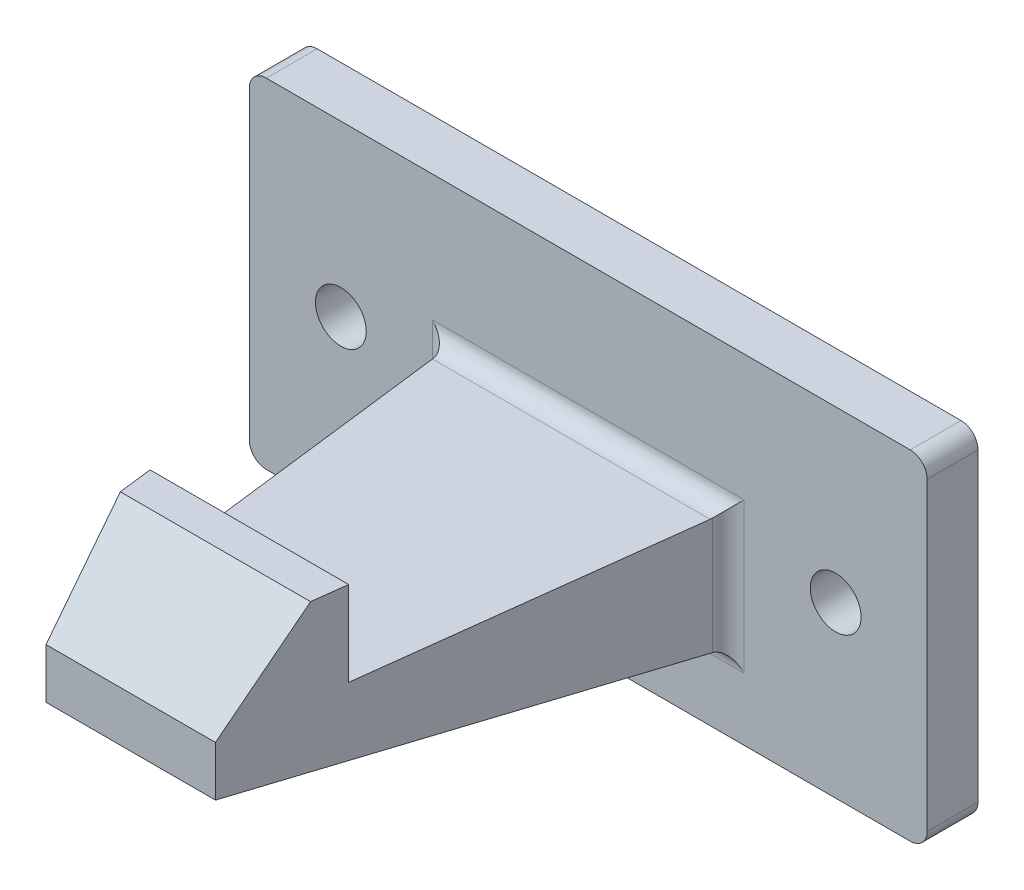
from build123d import *

# Parameters (mm, degrees)
SKETCH1_W           = 40
SKETCH1_H           = 20
BOSS_EXTRUDE1_DEPTH = 3
SNAP_START          = -1.4
SNAP_HOOK1_DEPTH    = 2.95
SNAP_START_2        = -8.315183144
SNAP_HOOK1_2_DEPTH  = 16.630366288
SNAP_START_3        = -5.859491926
SNAP_HOOK1_3_DEPTH  = 11.718983852
SNAP_START_4        = -6
SNAP_HOOK1_4_DEPTH  = 14
FILLET1_R           = 1
CUT_EXTRUDE1_REACH  = 37.057
SKETCH3_R           = 1.5
FILLET2_R           = 1


with BuildPart() as part:
    # Sketch1 → Boss-Extrude1 (new body)
    with BuildSketch(Plane.XY):
        Rectangle(SKETCH1_W, SKETCH1_H)
    extrude(amount=BOSS_EXTRUDE1_DEPTH)

    # Snap Hook1: read off the stored shape, not the designer's step
    # Snap Hook1 outline → Snap Hook1 (add)
    with BuildSketch(Plane(origin=(0, 0, 0), x_dir=(1, 0, 0), z_dir=(0, 1, 0)).offset(SNAP_START)):
        Polygon((8.315183144, -3), (-8.315183144, -3), (-5, -30), (5, -30), align=None)
    extrude(amount=SNAP_HOOK1_DEPTH)

    # Snap Hook1 2 outline → Snap Hook1 2 (add)
    with BuildSketch(Plane.YZ.offset(SNAP_START_2)):
        Polygon((-1.4, 3), (-1.4, 30), (-5.45, 3), align=None)
    extrude(amount=SNAP_HOOK1_2_DEPTH)

    # Snap Hook1 3 outline → Snap Hook1 3 (add)
    with BuildSketch(Plane.YZ.offset(SNAP_START_3)):
        Polygon((1.55, 30), (1.55, 23), (6.55, 23), (6.55, 25), align=None)
    extrude(amount=SNAP_HOOK1_3_DEPTH)

    # Snap Hook1 4 outline → Snap Hook1 4 (cut)
    with BuildSketch(Plane(origin=(0, 0, 0), x_dir=(1, 0, 0), z_dir=(0, 1, 0)).offset(SNAP_START_4)):
        Polygon((-8.315183144, -3), (-8.315183144, -31), (-4.877215439, -31), (-5, -30), align=None)
        Polygon((5, -30), (4.877215439, -31), (8.315183144, -31), (8.315183144, -3), align=None)
    extrude(amount=SNAP_HOOK1_4_DEPTH, mode=Mode.SUBTRACT)

    # Fillet1
    # the kernel refuses this fillet: 1 mm, written as the material it adds along each edge
    with BuildSketch(Plane(origin=(10.815183144, 1.55, 3), x_dir=(0, 1, 0), z_dir=(-1, 0, 0))) as fillet1_piece_1_section:
        with BuildLine():
            CenterArc((FILLET1_R, -FILLET1_R), FILLET1_R, 90, 90)
            Line((0, -FILLET1_R), (0, 0))
            Line((0, 0), (FILLET1_R, 0))
        make_face()
    fillet1_piece_1 = extrude(amount=21.630366288, mode=Mode.PRIVATE)
    fillet1_piece_1 = split(fillet1_piece_1, bisect_by=Plane(origin=(-8.031056326, 1.55, 5.314027238), z_dir=(0.9925461516430047, 0, -0.12186934339144287)), keep=Keep.TOP, mode=Mode.PRIVATE)
    fillet1_piece_1 = split(fillet1_piece_1, bisect_by=Plane(origin=(8.352313486, 1.55, 2.697597631), z_dir=(-0.9925461516430047, 0, -0.12186934339144287)), keep=Keep.TOP, mode=Mode.PRIVATE)
    add(fillet1_piece_1)
    with BuildSketch(Plane(origin=(8.315183144, 1.55, 3), x_dir=(1, 0, 0), z_dir=(0, -1, 0))) as fillet1_piece_2_section:
        with BuildLine():
            CenterArc((FILLET1_R * 0.884725264568, FILLET1_R), FILLET1_R, 186.999999999, 83.000000001)
            Line((-FILLET1_R * 0.107820887075, FILLET1_R * 0.878130656609), (0, 0))
            Line((0, 0), (FILLET1_R * 0.884725264568, 0))
        make_face()
    fillet1_piece_2 = extrude(amount=9.211813161, mode=Mode.PRIVATE)
    fillet1_piece_2 = split(fillet1_piece_2, bisect_by=Plane(origin=(8.315183144, -5.29596577, 4.026894866), z_dir=(0, 0.9889363528682975, -0.14834045293024464)), keep=Keep.TOP, mode=Mode.PRIVATE)
    add(fillet1_piece_2)
    with BuildSketch(Plane(origin=(-10.468151696, -5.45, 3), x_dir=(0, -1, 0), z_dir=(1, 0, 0))) as fillet1_piece_3_section:
        with BuildLine():
            CenterArc((FILLET1_R * 0.861187420808, -FILLET1_R), FILLET1_R, 90, 81.46923439)
            Line((-FILLET1_R * 0.12774893206, -FILLET1_R * 0.85165954707), (0, 0))
            Line((0, 0), (FILLET1_R * 0.861187420808, 0))
        make_face()
    fillet1_piece_3 = extrude(amount=20.936303392, mode=Mode.PRIVATE)
    fillet1_piece_3 = split(fillet1_piece_3, bisect_by=Plane(origin=(-8.347159328, -5.45, 2.739574883), z_dir=(0.9925461516430047, 0, -0.12186934339144287)), keep=Keep.TOP, mode=Mode.PRIVATE)
    fillet1_piece_3 = split(fillet1_piece_3, bisect_by=Plane(origin=(8.036210484, -5.45, 5.272049985), z_dir=(-0.9925461516430047, 0, -0.12186934339144287)), keep=Keep.TOP, mode=Mode.PRIVATE)
    add(fillet1_piece_3)
    with BuildSketch(Plane(origin=(-8.315183144, -7.661813161, 3), x_dir=(-1, 0, 0), z_dir=(0, 1, 0))) as fillet1_piece_4_section:
        with BuildLine():
            CenterArc((FILLET1_R * 0.884725264568, FILLET1_R), FILLET1_R, 186.999999999, 83.000000001)
            Line((-FILLET1_R * 0.107820887075, FILLET1_R * 0.878130656609), (0, 0))
            Line((0, 0), (FILLET1_R * 0.884725264568, 0))
        make_face()
    fillet1_piece_4 = extrude(amount=9.211813161, mode=Mode.PRIVATE)
    fillet1_piece_4 = split(fillet1_piece_4, bisect_by=Plane(origin=(-8.315183144, -5.498670705, 2.675528632), z_dir=(0, 0.9889363528682975, -0.14834045293024464)), keep=Keep.TOP, mode=Mode.PRIVATE)
    add(fillet1_piece_4)
    with BuildSketch(Plane(origin=(8.315183144, 3.761813161, 3), x_dir=(1, 0, 0), z_dir=(0, -1, 0))) as fillet1_piece_5a_section:
        with BuildLine():
            CenterArc((FILLET1_R * 0.884725264568, FILLET1_R), FILLET1_R, 186.999999999, 83.000000001)
            Line((-FILLET1_R * 0.107820887075, FILLET1_R * 0.878130656609), (0, 0))
            Line((0, 0), (FILLET1_R * 0.884725264568, 0))
        make_face()
    fillet1_piece_5a = extrude(amount=11.423626323, mode=Mode.PRIVATE)
    fillet1_piece_5a = split(fillet1_piece_5a, bisect_by=Plane(origin=(8.315183144, 1.55, 3), z_dir=(0, 1, 0)), keep=Keep.TOP, mode=Mode.PRIVATE)
    with BuildSketch(Plane(origin=(10.815183144, 1.55, 3), x_dir=(0, 1, 0), z_dir=(-1, 0, 0))) as fillet1_piece_5b_section:
        with BuildLine():
            CenterArc((FILLET1_R, -FILLET1_R), FILLET1_R, 90, 90)
            Line((0, -FILLET1_R), (0, 0))
            Line((0, 0), (FILLET1_R, 0))
        make_face()
    fillet1_piece_5b = extrude(amount=21.630366288, mode=Mode.PRIVATE)
    fillet1_piece_5b = split(fillet1_piece_5b, bisect_by=Plane(origin=(8.352313486, 1.55, 2.697597631), z_dir=(0.9925461516430047, 0, 0.12186934339144287)), keep=Keep.TOP, mode=Mode.PRIVATE)
    fillet1_piece_5 = fillet1_piece_5a & fillet1_piece_5b
    add(fillet1_piece_5)
    with BuildSketch(Plane(origin=(10.815183144, 1.55, 3), x_dir=(0, 1, 0), z_dir=(-1, 0, 0))) as fillet1_piece_6a_section:
        with BuildLine():
            CenterArc((FILLET1_R, -FILLET1_R), FILLET1_R, 90, 90)
            Line((0, -FILLET1_R), (0, 0))
            Line((0, 0), (FILLET1_R, 0))
        make_face()
    fillet1_piece_6a = extrude(amount=21.630366288, mode=Mode.PRIVATE)
    fillet1_piece_6a = split(fillet1_piece_6a, bisect_by=Plane(origin=(-8.031056326, 1.55, 5.314027238), z_dir=(-0.9925461516430047, 0, 0.12186934339144287)), keep=Keep.TOP, mode=Mode.PRIVATE)
    with BuildSketch(Plane(origin=(-8.315183144, -7.661813161, 3), x_dir=(-1, 0, 0), z_dir=(0, 1, 0))) as fillet1_piece_6b_section:
        with BuildLine():
            CenterArc((FILLET1_R * 0.884725264568, FILLET1_R), FILLET1_R, 186.999999999, 83.000000001)
            Line((-FILLET1_R * 0.107820887075, FILLET1_R * 0.878130656609), (0, 0))
            Line((0, 0), (FILLET1_R * 0.884725264568, 0))
        make_face()
    fillet1_piece_6b = extrude(amount=11.423626323, mode=Mode.PRIVATE)
    fillet1_piece_6b = split(fillet1_piece_6b, bisect_by=Plane(origin=(-8.315183144, 1.55, 3), z_dir=(0, 1, 0)), keep=Keep.TOP, mode=Mode.PRIVATE)
    fillet1_piece_6 = fillet1_piece_6a & fillet1_piece_6b
    add(fillet1_piece_6)
    with BuildSketch(Plane(origin=(-10.468151696, -5.45, 3), x_dir=(0, -1, 0), z_dir=(1, 0, 0))) as fillet1_piece_7a_section:
        with BuildLine():
            CenterArc((FILLET1_R * 0.861187420808, -FILLET1_R), FILLET1_R, 90, 81.46923439)
            Line((-FILLET1_R * 0.12774893206, -FILLET1_R * 0.85165954707), (0, 0))
            Line((0, 0), (FILLET1_R * 0.861187420808, 0))
        make_face()
    fillet1_piece_7a = extrude(amount=20.936303392, mode=Mode.PRIVATE)
    fillet1_piece_7a = split(fillet1_piece_7a, bisect_by=Plane(origin=(8.036210484, -5.45, 5.272049985), z_dir=(0.9925461516430047, 0, 0.12186934339144287)), keep=Keep.TOP, mode=Mode.PRIVATE)
    with BuildSketch(Plane(origin=(8.315183144, 1.55, 3), x_dir=(1, 0, 0), z_dir=(0, -1, 0))) as fillet1_piece_7b_section:
        with BuildLine():
            CenterArc((FILLET1_R * 0.884725264568, FILLET1_R), FILLET1_R, 186.999999999, 83.000000001)
            Line((-FILLET1_R * 0.107820887075, FILLET1_R * 0.878130656609), (0, 0))
            Line((0, 0), (FILLET1_R * 0.884725264568, 0))
        make_face()
    fillet1_piece_7b = extrude(amount=9.211813161, mode=Mode.PRIVATE)
    fillet1_piece_7b = split(fillet1_piece_7b, bisect_by=Plane(origin=(8.315183144, -5.29596577, 4.026894866), z_dir=(0, -0.9889363528682975, 0.14834045293024464)), keep=Keep.TOP, mode=Mode.PRIVATE)
    fillet1_piece_7 = fillet1_piece_7a & fillet1_piece_7b
    add(fillet1_piece_7)
    with BuildSketch(Plane(origin=(-10.468151696, -5.45, 3), x_dir=(0, -1, 0), z_dir=(1, 0, 0))) as fillet1_piece_8a_section:
        with BuildLine():
            CenterArc((FILLET1_R * 0.861187420808, -FILLET1_R), FILLET1_R, 90, 81.46923439)
            Line((-FILLET1_R * 0.12774893206, -FILLET1_R * 0.85165954707), (0, 0))
            Line((0, 0), (FILLET1_R * 0.861187420808, 0))
        make_face()
    fillet1_piece_8a = extrude(amount=20.936303392, mode=Mode.PRIVATE)
    fillet1_piece_8a = split(fillet1_piece_8a, bisect_by=Plane(origin=(-8.347159328, -5.45, 2.739574883), z_dir=(-0.9925461516430047, 0, 0.12186934339144287)), keep=Keep.TOP, mode=Mode.PRIVATE)
    with BuildSketch(Plane(origin=(-8.315183144, -7.661813161, 3), x_dir=(-1, 0, 0), z_dir=(0, 1, 0))) as fillet1_piece_8b_section:
        with BuildLine():
            CenterArc((FILLET1_R * 0.884725264568, FILLET1_R), FILLET1_R, 186.999999999, 83.000000001)
            Line((-FILLET1_R * 0.107820887075, FILLET1_R * 0.878130656609), (0, 0))
            Line((0, 0), (FILLET1_R * 0.884725264568, 0))
        make_face()
    fillet1_piece_8b = extrude(amount=9.211813161, mode=Mode.PRIVATE)
    fillet1_piece_8b = split(fillet1_piece_8b, bisect_by=Plane(origin=(-8.315183144, -5.498670705, 2.675528632), z_dir=(0, -0.9889363528682975, 0.14834045293024464)), keep=Keep.TOP, mode=Mode.PRIVATE)
    fillet1_piece_8 = fillet1_piece_8a & fillet1_piece_8b
    add(fillet1_piece_8)

    # Sketch3 → Cut-Extrude1 (cut, up to next)
    with BuildSketch(Plane.XY.offset(3), mode=Mode.PRIVATE) as cut_extrude1_sk1:
        with Locations((-14.599954204, 0)):
            Circle(SKETCH3_R)
    cut_extrude1_tool1 = extrude(cut_extrude1_sk1.sketch, amount=-CUT_EXTRUDE1_REACH, mode=Mode.PRIVATE) & part.part
    cut_extrude1 = cut_extrude1_tool1.solids().sort_by_distance((-14.599954, 0, 3))[0]
    add(cut_extrude1, mode=Mode.SUBTRACT)

    # Mirror1: Cut-Extrude1 across plane
    add(cut_extrude1.mirror(Plane(origin=(0, 0, 0), x_dir=(0, 0, 1), z_dir=(1, 0, 0))), mode=Mode.SUBTRACT)

    # Fillet2
    fillet2_edges = [part.edges().sort_by_distance(p)[0] for p in [
        (20, -10, 1.5),
        (-20, -10, 1.5),
        (-20, 10, 1.5),
        (20, 10, 1.5),
    ]]
    fillet(fillet2_edges, radius=FILLET2_R)


solid = part.part
